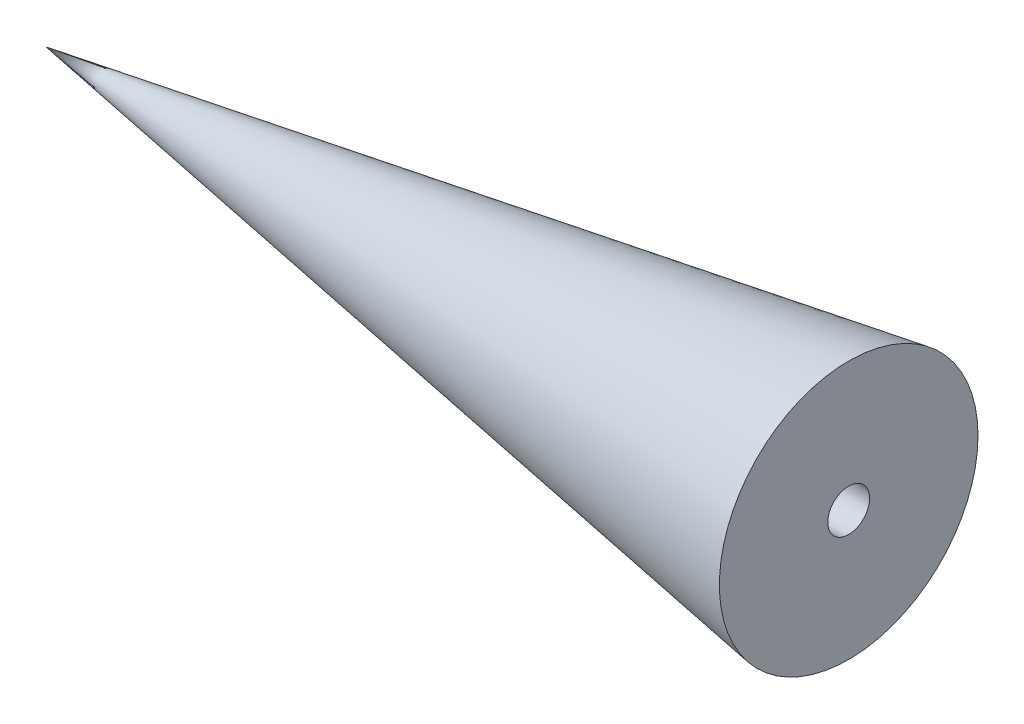
from build123d import *

# Parameters (mm, degrees)
SKETCH2_R          = 3
CUT_EXTRUDE1_DEPTH = 40


with BuildPart() as part:
    # Sketch1 → Revolve1 (revolve)
    with BuildSketch(Plane.XY):
        Polygon((0, 0), (0, 18.525), (-115, 0), align=None)
    revolve(axis=Axis((0, 0, 0), (-1, 0, 0)))

    # Sketch2 → Cut-Extrude1 (cut)
    with BuildSketch(Plane(origin=(0, 0, 0), x_dir=(0, 0, -1), z_dir=(1, 0, 0))):
        Circle(SKETCH2_R)
    extrude(amount=-CUT_EXTRUDE1_DEPTH, mode=Mode.SUBTRACT)


solid = part.part
